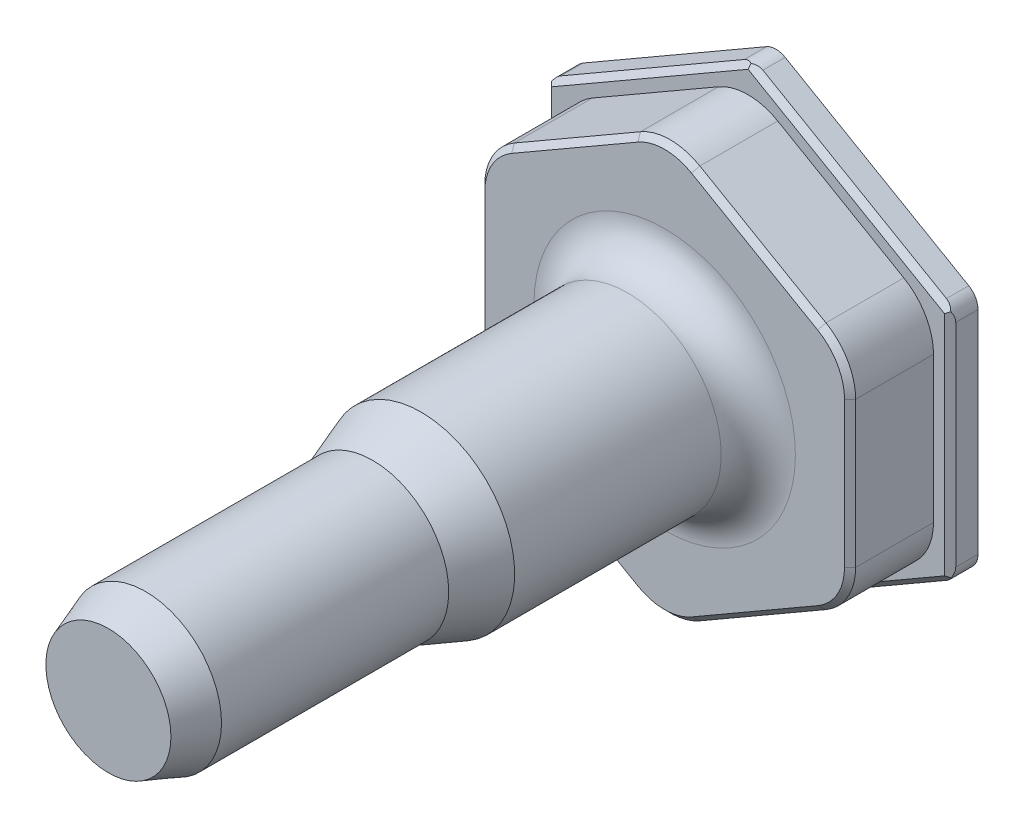
from build123d import *

# Parameters (mm, degrees)
BOSS_EXTRUDE1_DEPTH  = 1.5
SKETCH1_8_R          = 4.1
BOSS_EXTRUDE3_DEPTH  = 36
SKETCH1_9_R          = 5.05
BOSS_EXTRUDE4_DEPTH  = 19
SHELL1_START         = 2
SHELL1_OUTLINE_R     = 2.1
SHELL1_DEPTH         = 32
SHELL1_2_OUTLINE_R   = 3.05
SHELL1_2_OUTLINE_R_2 = 2.1
SHELL1_2_DEPTH       = 15
SKETCH1_10_R         = 3.25
CUT_EXTRUDE1_DEPTH   = 17
SKETCH1_3_R          = 3.25
BOSS_EXTRUDE2_DEPTH  = 6
CHAMFER1_SIZE        = 2
CHAMFER1_SIZE2       = 0.727940469
CHAMFER2_SIZE        = 2.747477419
CHAMFER2_SIZE_2      = 1
CHAMFER3_SIZE        = 1.212435565
CHAMFER3_SIZE_2      = 0.7
CHAMFER6_SIZE        = 0.3
FILLET1_R            = 3.2
CHAMFER5_SIZE        = 0.3
FILLET2_R            = 1
FILLET3_R            = 2


# Read off the part's stored shape, not the designer's step: Shell1
with BuildPart() as part:
    # Sketch1 → Boss-Extrude1 (new body)
    with BuildSketch(Plane.XY):
        Polygon((-10.9, 6.293117934), (0, 12.586235868), (10.9, 6.293117934), (10.9, -6.293117934), (0, -12.586235868), (-10.9, -6.293117934), align=None)
    extrude(amount=BOSS_EXTRUDE1_DEPTH)

    # Sketch1<8> → Boss-Extrude3 (add)
    with BuildSketch(Plane.XY):
        with Locations(Location((0, 0, 0), (0, 0, 180))):
            Circle(SKETCH1_8_R)
    extrude(amount=BOSS_EXTRUDE3_DEPTH)

    # Sketch1<9> → Boss-Extrude4 (add)
    with BuildSketch(Plane.XY):
        with Locations(Location((0, 0, 0), (0, 0, 180))):
            Circle(SKETCH1_9_R)
    extrude(amount=BOSS_EXTRUDE4_DEPTH)

    # Shell1 outline → Shell1 (cut)
    with BuildSketch(Plane.XY.offset(SHELL1_START)):
        Circle(SHELL1_OUTLINE_R)
    extrude(amount=SHELL1_DEPTH, mode=Mode.SUBTRACT)

    # Shell1 2 outline → Shell1 2 (cut)
    with BuildSketch(Plane.XY.offset(SHELL1_START)):
        Circle(SHELL1_2_OUTLINE_R)
        Circle(SHELL1_2_OUTLINE_R_2, mode=Mode.SUBTRACT)
    extrude(amount=SHELL1_2_DEPTH, mode=Mode.SUBTRACT)

    # Sketch1<10> → Cut-Extrude1 (cut)
    with BuildSketch(Plane.XY):
        Circle(SKETCH1_10_R)
    extrude(amount=CUT_EXTRUDE1_DEPTH, mode=Mode.SUBTRACT)

    # Sketch1<3> → Boss-Extrude2 (add)
    with BuildSketch(Plane.XY):
        Polygon((0, 11.547005384), (10, 5.773502692), (10, -5.773502692), (0, -11.547005384), (-10, -5.773502692), (-10, 5.773502692), align=None)
        Circle(SKETCH1_3_R, mode=Mode.SUBTRACT)
    extrude(amount=BOSS_EXTRUDE2_DEPTH)

    # Chamfer1
    chamfer1_edges = [part.edges().sort_by_distance(p)[0] for p in [
        (4.1, 0, 36),
    ]]
    chamfer1_side = [part.faces().sort_by_distance(p)[0] for p in [
        (4.1, 0, 27.5),
    ]]
    chamfer(chamfer1_edges, length=CHAMFER1_SIZE, length2=CHAMFER1_SIZE2, reference=chamfer1_side[0])

    # Chamfer2
    # the kernel refuses this chamfer: 2.747477419, 1 mm, written as the material it adds along each edge
    with BuildSketch(Plane(origin=(0, 0, 19), x_dir=(-1, 0, 0), z_dir=(0, -1, 0))) as chamfer2_piece_1_section:
        Polygon((4.1, -CHAMFER2_SIZE), (4.1 + CHAMFER2_SIZE_2, 0), (4.1, 0), align=None)
    chamfer2_piece_1 = revolve(axis=Axis((0, 0, 19), (0, 0, -1)), mode=Mode.PRIVATE)
    chamfer2_piece_1 = chamfer2_piece_1 & Plane(origin=(0, 0, 20.481947897), x_dir=(-1, 0, 0), z_dir=(0, 0, -1)) * Cylinder(5.05, 21, mode=Mode.PRIVATE)
    add(chamfer2_piece_1)

    # Chamfer3
    # the kernel refuses this chamfer: 1.212435565, 0.7 mm, written as the material it takes off along each edge
    with BuildSketch(Plane(origin=(0, 0, 17), x_dir=(1, 0, 0), z_dir=(0, -1, 0))) as chamfer3_piece_1_section:
        Polygon((2.1 + CHAMFER3_SIZE, 0), (2.1, CHAMFER3_SIZE_2), (2.1, 0), align=None)
    chamfer3_piece_1 = revolve(axis=Axis((0, 0, 17), (0, 0, 1)), mode=Mode.PRIVATE)
    chamfer3_piece_1 = chamfer3_piece_1 & Plane(origin=(0, 0, 17.363214185), x_dir=(1, 0, 0), z_dir=(0, 0, -1)) * Cylinder(3.25, 14, mode=Mode.PRIVATE)
    add(chamfer3_piece_1, mode=Mode.SUBTRACT)

    # Chamfer6
    chamfer6_edges = [part.edges().sort_by_distance(p)[0] for p in [
        (-3.25, 0, 0),
    ]]
    chamfer(chamfer6_edges, length=CHAMFER6_SIZE)

    # Fillet1
    fillet1_edges = [part.edges().sort_by_distance(p)[0] for p in [
        (-10, -5.773502692, 3.75),
        (0, -11.547005384, 3.75),
        (10, -5.773502692, 3.75),
        (10, 5.773502692, 3.75),
        (0, 11.547005384, 3.75),
        (-10, 5.773502692, 3.75),
    ]]
    fillet(fillet1_edges, radius=FILLET1_R)

    # Chamfer5
    chamfer5_edges = [part.edges().sort_by_distance(p)[0] for p in [
        (-5, -8.660254038, 6),
        (5, 8.660254038, 6),
        (-5, 8.660254038, 6),
        (-10, 0, 6),
        (9.571281292, 5.52598183, 6),
        (0, 11.051963661, 6),
        (-9.571281292, 5.52598183, 6),
        (-9.571281292, -5.52598183, 6),
        (0, -11.051963661, 6),
        (9.571281292, -5.52598183, 6),
        (5.45, 9.439676901, 1.5),
        (10.9, 0, 1.5),
        (5.45, -9.439676901, 1.5),
        (-5.45, -9.439676901, 1.5),
        (-10.9, 0, 1.5),
        (-5.45, 9.439676901, 1.5),
        (10, 0, 6),
        (5, -8.660254038, 6),
    ]]
    chamfer(chamfer5_edges, length=CHAMFER5_SIZE)

    # Fillet2
    fillet2_edges = [part.edges().sort_by_distance(p)[0] for p in [
        (10.9, 6.293117934, 0.6),
        (10.9, -6.293117934, 0.6),
        (0, -12.586235868, 0.6),
        (-10.9, -6.293117934, 0.6),
        (-10.9, 6.293117934, 0.6),
        (0, 12.586235868, 0.6),
    ]]
    fillet(fillet2_edges, radius=FILLET2_R)

    # Fillet3
    fillet3_edges = [part.edges().sort_by_distance(p)[0] for p in [
        (5.05, 0, 6),
    ]]
    fillet(fillet3_edges, radius=FILLET3_R)


solid = part.part
